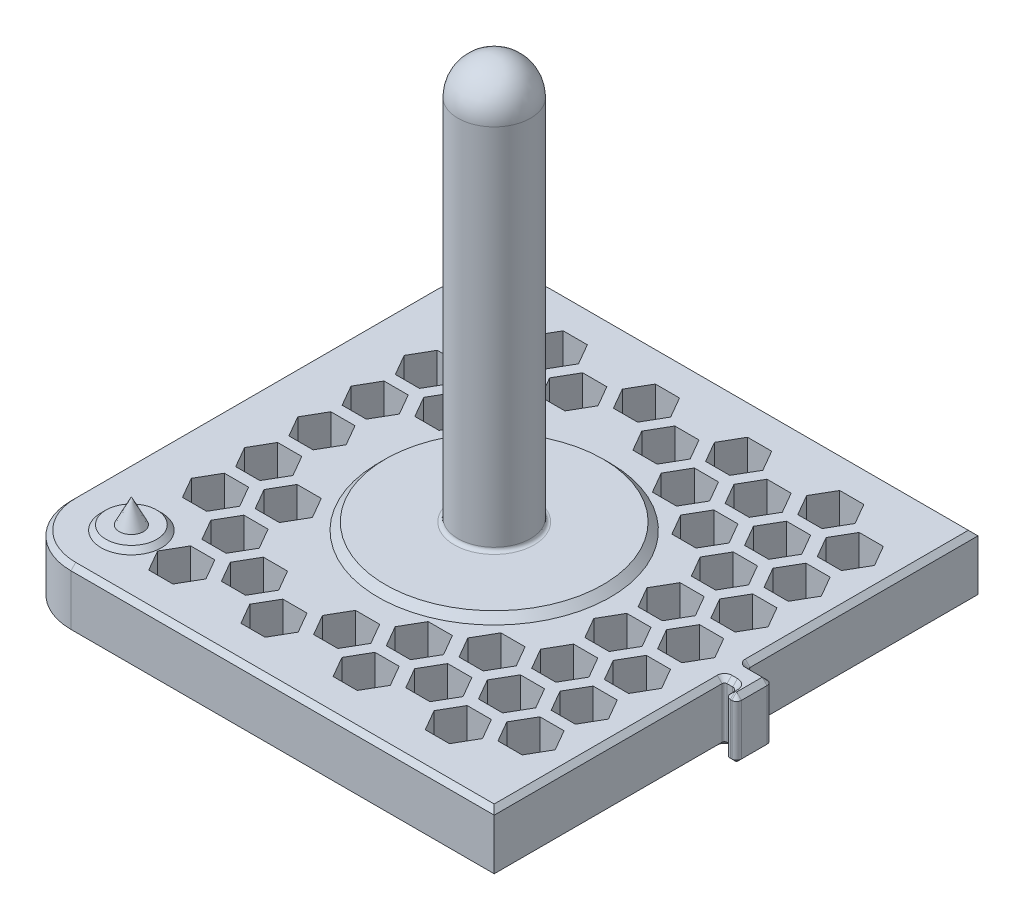
from build123d import *

# Parameters (mm, degrees)
SKETCH1_W                = 200
SKETCH1_H                = 200
BOSS_EXTRUDE1_DEPTH      = 25
SKETCH2_R                = 15
BOSS_EXTRUDE2_DEPTH      = 170
BOSS_EXTRUDE3_DEPTH      = 25
FILLET1_R                = 1
FILLET2_R                = 25
FILLET3_R                = 15
SKETCH5_R                = 45
BOSS_EXTRUDE4_DEPTH      = 3
CHAMFER1_SIZE            = 3
FILLET4_R                = 1.5
CHAMFER2_SIZE            = 2
CHAMFER3_SIZE            = 2
SKETCH6_R                = 12.5
BOSS_EXTRUDE5_DEPTH      = 2
CHAMFER4_SIZE            = 2
CHAMFER4_OF_MIRROR1_SIZE = 2
FILL_PATTERN1_DEPTH      = 25


# Read off the part's stored shape, not the designer's step: Fill Pattern1
with BuildPart() as part:
    # Sketch1 → Boss-Extrude1 (new body)
    with BuildSketch(Plane(origin=(0, 0, 0), x_dir=(1, 0, 0), z_dir=(0, 1, 0))):
        Rectangle(SKETCH1_W, SKETCH1_H)
    extrude(amount=BOSS_EXTRUDE1_DEPTH)

    # Sketch2 → Boss-Extrude2 (add)
    with BuildSketch(Plane(origin=(0, 25, 0), x_dir=(1, 0, 0), z_dir=(0, 1, 0))):
        with Locations(Location((0, 0, 0), (0, 0, 270))):
            Circle(SKETCH2_R)
    extrude(amount=BOSS_EXTRUDE2_DEPTH)

    # Sketch4 → Boss-Extrude3 (add)
    with BuildSketch(Plane(origin=(0, 0, 0), x_dir=(1, 0, 0), z_dir=(0, 1, 0))):
        with BuildLine():
            Line((100, 4.8), (108, 4.8))
            ThreePointArc((108, 4.8), (109.414213562, 4.214213562), (110, 2.8))
            Line((110, 2.8), (110, -7.8))
            ThreePointArc((110, -7.8), (109.414213562, -9.214213562), (108, -9.8))
            Line((108, -9.8), (107.4, -9.8))
            ThreePointArc((107.4, -9.8), (105.985786438, -9.214213562), (105.4, -7.8))
            Line((105.4, -7.8), (105.4, -6.8))
            ThreePointArc((105.4, -6.8), (104.814213562, -5.385786438), (103.4, -4.8))
            Line((103.4, -4.8), (100, -4.8))
            Line((100, -4.8), (100, 4.8))
        make_face()
    extrude(amount=BOSS_EXTRUDE3_DEPTH)

    # Fillet1
    fillet1_edges = [part.edges().sort_by_distance(p)[0] for p in [
        (100, 12.5, -4.8),
        (100, 12.5, 4.8),
    ]]
    fillet(fillet1_edges, radius=FILLET1_R)

    # Fillet2
    fillet2_edges = [part.edges().sort_by_distance(p)[0] for p in [
        (-100, 12.5, -100),
        (-100, 12.5, 100),
    ]]
    fillet(fillet2_edges, radius=FILLET2_R)

    # Fillet3
    fillet3_edges = [part.edges().sort_by_distance(p)[0] for p in [
        (0, 195, -15),
    ]]
    fillet(fillet3_edges, radius=FILLET3_R)

    # Sketch5 → Boss-Extrude4 (add)
    with BuildSketch(Plane(origin=(0, 25, 0), x_dir=(1, 0, 0), z_dir=(0, 1, 0))):
        with Locations(Location((0, 0, 0), (0, 0, 270))):
            Circle(SKETCH5_R)
    extrude(amount=BOSS_EXTRUDE4_DEPTH)

    # Chamfer1
    chamfer1_edges = [part.edges().sort_by_distance(p)[0] for p in [
        (0, 25, -45),
    ]]
    chamfer(chamfer1_edges, length=CHAMFER1_SIZE - 0.0001)  # a hair under: the kernel refuses the full size

    # Fillet4
    fillet4_edges = [part.edges().sort_by_distance(p)[0] for p in [
        (0, 28, -15),
    ]]
    fillet(fillet4_edges, radius=FILLET4_R)

    # Chamfer2
    chamfer2_edges = [part.edges().sort_by_distance(p)[0] for p in [
        (100, 25, 52.9),
        (12.5, 25, -100),
        (104.814213562, 25, 5.385786438),
        (105.4, 25, 7.3),
        (105.985786438, 25, 9.214213562),
        (107.7, 25, 9.8),
        (109.414213562, 25, 9.214213562),
        (110, 25, 2.5),
        (109.414213562, 25, -4.214213562),
        (104.5, 25, -4.8),
        (100, 25, -52.9),
        (102.2, 25, 4.8),
        (100.292893219, 25, -5.092893219),
        (100.292893219, 25, 5.092893219),
        (-100, 25, 0),
        (12.5, 25, 100),
        (-92.67766953, 25, 92.67766953),
        (-92.67766953, 25, -92.67766953),
    ]]
    chamfer(chamfer2_edges, length=CHAMFER2_SIZE - 0.0001)  # a hair under: the kernel refuses the full size

    # Chamfer3
    chamfer3_edges = [part.edges().sort_by_distance(p)[0] for p in [
        (104.814213562, 0, 5.385786438),
        (105.4, 0, 7.3),
        (105.985786438, 0, 9.214213562),
        (107.7, 0, 9.8),
        (109.414213562, 0, 9.214213562),
        (110, 0, 2.5),
        (109.414213562, 0, -4.214213562),
        (104.5, 0, -4.8),
        (100, 0, -52.9),
        (102.2, 0, 4.8),
        (100.292893219, 0, -5.092893219),
        (100.292893219, 0, 5.092893219),
        (12.5, 0, -100),
        (100, 0, 52.9),
        (-100, 0, 0),
        (12.5, 0, 100),
        (-92.67766953, 0, 92.67766953),
        (-92.67766953, 0, -92.67766953),
    ]]
    chamfer(chamfer3_edges, length=CHAMFER3_SIZE)

    # Sketch6 → Boss-Extrude5 (add)
    with BuildSketch(Plane(origin=(0, 25, 0), x_dir=(1, 0, 0), z_dir=(0, 1, 0))):
        with Locations(Location((-75, 75, 0), (0, 0, 270))):
            Circle(SKETCH6_R)
    boss_extrude5 = extrude(amount=BOSS_EXTRUDE5_DEPTH)

    # Sketch7 → Revolve1 (revolve)
    with BuildSketch(Plane(origin=(0, 0, -75), x_dir=(0, -1, 0), z_dir=(0, 0, 1)), mode=Mode.PRIVATE) as revolve1_sk:
        Polygon((-27, -70), (-27, -75), (-37, -75), align=None)
    revolve1 = revolve(revolve1_sk.sketch.rotate(Axis((-75, 27, -75), (0, 1, 0)), 90), axis=Axis((-75, 27, -75), (0, 1, 0)))

    # Chamfer4
    chamfer4_edges = [part.edges().sort_by_distance(p)[0] for p in [
        (-75, 27, -87.5),
    ]]
    chamfer(chamfer4_edges, length=CHAMFER4_SIZE - 0.0001)  # a hair under: the kernel refuses the full size

    # Mirror1: Boss-Extrude5, Revolve1 across plane
    add(boss_extrude5.mirror(Plane.XY))
    add(revolve1.mirror(Plane.XY))

    # Chamfer4 of Mirror1
    chamfer4_of_mirror1_edges = [part.edges().sort_by_distance(p)[0] for p in [
        (-75, 27, 87.5),
    ]]
    chamfer(chamfer4_of_mirror1_edges, length=CHAMFER4_OF_MIRROR1_SIZE - 0.0001)  # a hair under: the kernel refuses the full size

    # Fill Pattern1 outline → Fill Pattern1 (cut)
    with BuildSketch(Plane(origin=(0, 0, 0), x_dir=(1, 0, 0), z_dir=(0, 1, 0))):
        Polygon((-62.15767665, 77), (-57.15767665, 68.339745962), (-47.15767665, 68.339745962), (-42.15767665, 77), (-47.15767665, 85.660254038), (-57.15767665, 85.660254038), align=None)
        Polygon((14.052558883, -55), (19.052558883, -63.660254038), (29.052558883, -63.660254038), (34.052558883, -55), (29.052558883, -46.339745962), (19.052558883, -46.339745962), align=None)
        Polygon((57.15767665, 68.339745962), (67.15767665, 68.339745962), (72.15767665, 77), (67.15767665, 85.660254038), (57.15767665, 85.660254038), (52.15767665, 77), align=None)
        Polygon((19.052558883, 68.339745962), (29.052558883, 68.339745962), (34.052558883, 77), (29.052558883, 85.660254038), (19.052558883, 85.660254038), (14.052558883, 77), align=None)
        Polygon((-19.052558883, 68.339745962), (-9.052558883, 68.339745962), (-4.052558883, 77), (-9.052558883, 85.660254038), (-19.052558883, 85.660254038), (-24.052558883, 77), align=None)
        Polygon((-66.210235533, 35.339745962), (-61.210235533, 44), (-66.210235533, 52.660254038), (-76.210235533, 52.660254038), (-81.210235533, 44), (-76.210235533, 35.339745962), align=None)
        Polygon((-57.15767665, -63.660254038), (-47.15767665, -63.660254038), (-42.15767665, -55), (-47.15767665, -46.339745962), (-57.15767665, -46.339745962), (-62.15767665, -55), align=None)
        Polygon((57.15767665, -63.660254038), (67.15767665, -63.660254038), (72.15767665, -55), (67.15767665, -46.339745962), (57.15767665, -46.339745962), (52.15767665, -55), align=None)
        Polygon((67.15767665, 2.339745962), (72.15767665, 11), (67.15767665, 19.660254038), (57.15767665, 19.660254038), (52.15767665, 11), (57.15767665, 2.339745962), align=None)
        Polygon((86.210235533, 35.339745962), (91.210235533, 44), (86.210235533, 52.660254038), (76.210235533, 52.660254038), (71.210235533, 44), (76.210235533, 35.339745962), align=None)
        Polygon((-62.15767665, -77), (-57.15767665, -85.660254038), (-47.15767665, -85.660254038), (-42.15767665, -77), (-47.15767665, -68.339745962), (-57.15767665, -68.339745962), align=None)
        Polygon((-81.210235533, -44), (-76.210235533, -52.660254038), (-66.210235533, -52.660254038), (-61.210235533, -44), (-66.210235533, -35.339745962), (-76.210235533, -35.339745962), align=None)
        Polygon((-19.052558883, -85.660254038), (-9.052558883, -85.660254038), (-4.052558883, -77), (-9.052558883, -68.339745962), (-19.052558883, -68.339745962), (-24.052558883, -77), align=None)
        Polygon((19.052558883, -85.660254038), (29.052558883, -85.660254038), (34.052558883, -77), (29.052558883, -68.339745962), (19.052558883, -68.339745962), (14.052558883, -77), align=None)
        Polygon((57.15767665, -85.660254038), (67.15767665, -85.660254038), (72.15767665, -77), (67.15767665, -68.339745962), (57.15767665, -68.339745962), (52.15767665, -77), align=None)
        Polygon((29.052558883, 46.339745962), (34.052558883, 55), (29.052558883, 63.660254038), (19.052558883, 63.660254038), (14.052558883, 55), (19.052558883, 46.339745962), align=None)
        Polygon((76.210235533, -52.660254038), (86.210235533, -52.660254038), (91.210235533, -44), (86.210235533, -35.339745962), (76.210235533, -35.339745962), (71.210235533, -44), align=None)
        Polygon((38.105117767, -52.660254038), (48.105117767, -52.660254038), (53.105117767, -44), (48.105117767, -35.339745962), (38.105117767, -35.339745962), (33.105117767, -44), align=None)
        Polygon((-81.210235533, -22), (-76.210235533, -30.660254038), (-66.210235533, -30.660254038), (-61.210235533, -22), (-66.210235533, -13.339745962), (-76.210235533, -13.339745962), align=None)
        Polygon((76.210235533, -30.660254038), (86.210235533, -30.660254038), (91.210235533, -22), (86.210235533, -13.339745962), (76.210235533, -13.339745962), (71.210235533, -22), align=None)
        Polygon((-81.210235533, 22), (-76.210235533, 13.339745962), (-66.210235533, 13.339745962), (-61.210235533, 22), (-66.210235533, 30.660254038), (-76.210235533, 30.660254038), align=None)
        Polygon((67.15767665, 46.339745962), (72.15767665, 55), (67.15767665, 63.660254038), (57.15767665, 63.660254038), (52.15767665, 55), (57.15767665, 46.339745962), align=None)
        Polygon((-62.15767665, 55), (-57.15767665, 46.339745962), (-47.15767665, 46.339745962), (-42.15767665, 55), (-47.15767665, 63.660254038), (-57.15767665, 63.660254038), align=None)
        Polygon((86.210235533, 13.339745962), (91.210235533, 22), (86.210235533, 30.660254038), (76.210235533, 30.660254038), (71.210235533, 22), (76.210235533, 13.339745962), align=None)
        Polygon((67.15767665, -19.660254038), (72.15767665, -11), (67.15767665, -2.339745962), (57.15767665, -2.339745962), (52.15767665, -11), (57.15767665, -19.660254038), align=None)
        Polygon((-5, -66), (0, -74.660254038), (10, -74.660254038), (15, -66), (10, -57.339745962), (0, -57.339745962), align=None)
        Polygon((-62.15767665, 33), (-57.15767665, 24.339745962), (-47.15767665, 24.339745962), (-42.15767665, 33), (-47.15767665, 41.660254038), (-57.15767665, 41.660254038), align=None)
        Polygon((76.210235533, -74.660254038), (86.210235533, -74.660254038), (91.210235533, -66), (86.210235533, -57.339745962), (76.210235533, -57.339745962), (71.210235533, -66), align=None)
        Polygon((-38.105117767, -74.660254038), (-28.105117767, -74.660254038), (-23.105117767, -66), (-28.105117767, -57.339745962), (-38.105117767, -57.339745962), (-43.105117767, -66), align=None)
        Polygon((38.105117767, -74.660254038), (48.105117767, -74.660254038), (53.105117767, -66), (48.105117767, -57.339745962), (38.105117767, -57.339745962), (33.105117767, -66), align=None)
        Polygon((67.15767665, 24.339745962), (72.15767665, 33), (67.15767665, 41.660254038), (57.15767665, 41.660254038), (52.15767665, 33), (57.15767665, 24.339745962), align=None)
        Polygon((86.210235533, 57.339745962), (91.210235533, 66), (86.210235533, 74.660254038), (76.210235533, 74.660254038), (71.210235533, 66), (76.210235533, 57.339745962), align=None)
        Polygon((-5, 66), (0, 57.339745962), (10, 57.339745962), (15, 66), (10, 74.660254038), (0, 74.660254038), align=None)
        Polygon((52.15767665, -33), (57.15767665, -41.660254038), (67.15767665, -41.660254038), (72.15767665, -33), (67.15767665, -24.339745962), (57.15767665, -24.339745962), align=None)
        Polygon((-43.105117767, 66), (-38.105117767, 57.339745962), (-28.105117767, 57.339745962), (-23.105117767, 66), (-28.105117767, 74.660254038), (-38.105117767, 74.660254038), align=None)
        Polygon((38.105117767, 57.339745962), (48.105117767, 57.339745962), (53.105117767, 66), (48.105117767, 74.660254038), (38.105117767, 74.660254038), (33.105117767, 66), align=None)
        Polygon((-66.210235533, -8.660254038), (-61.210235533, 0), (-66.210235533, 8.660254038), (-76.210235533, 8.660254038), (-81.210235533, 0), (-76.210235533, -8.660254038), align=None)
        Polygon((-47.15767665, -41.660254038), (-42.15767665, -33), (-47.15767665, -24.339745962), (-57.15767665, -24.339745962), (-62.15767665, -33), (-57.15767665, -41.660254038), align=None)
        Polygon((71.210235533, 0), (76.210235533, -8.660254038), (86.210235533, -8.660254038), (91.210235533, 0), (86.210235533, 8.660254038), (76.210235533, 8.660254038), align=None)
        Polygon((33.105117767, 44), (38.105117767, 35.339745962), (48.105117767, 35.339745962), (53.105117767, 44), (48.105117767, 52.660254038), (38.105117767, 52.660254038), align=None)
    extrude(amount=FILL_PATTERN1_DEPTH, mode=Mode.SUBTRACT)


solid = part.part
